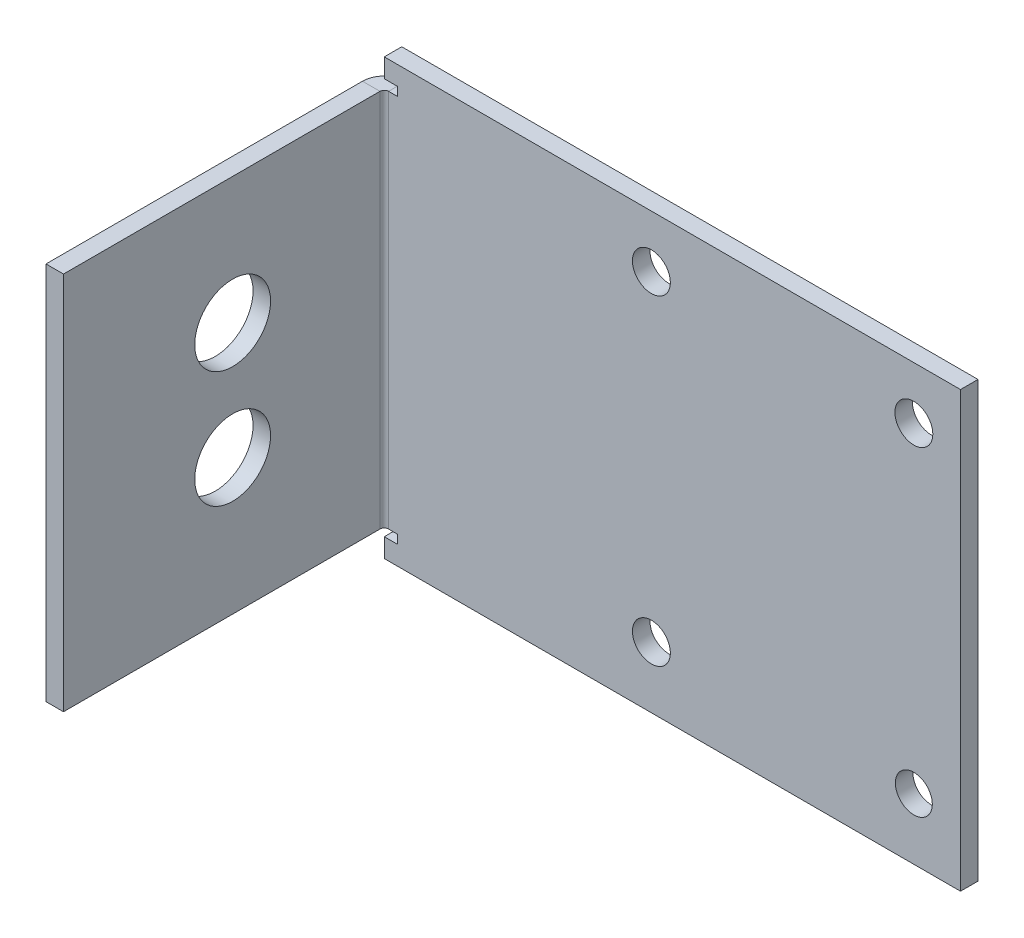
from build123d import *

# Parameters (mm, degrees)
IZIM1_W                       = 98.8
IZIM1_H                       = 74.5
TABAN_FLAN_1_DEPTH            = 3
KENAR_FLAN_1_STRIP_W          = 13.4732
KENAR_FLAN_1_STRIP_H          = 3
KENAR_FLAN_1_STRIP_CUT_DEPTH  = 65
KENAR_FLAN_1_RELIEF_W         = 14.9732
KENAR_FLAN_1_RELIEF_H         = 1.5
KENAR_FLAN_1_RELIEF_CUT_DEPTH = 3
KENAR_FLAN_1_DEPTH            = 65
IZIM9_R                       = 6.5
KES_EKSTR_ZYON1_DEPTH         = 10
IZIM11_R                      = 3.25
IZIM11_R_2                    = 3.166439954
KES_EKSTR_ZYON2_DEPTH         = 10


# Sheet-metal steps are written as plain solids
with BuildPart() as part:
    # Çizim1 → Taban-Flanş1 (new body)
    with BuildSketch(Plane.XY):
        Rectangle(IZIM1_W, IZIM1_H)
    extrude(amount=-TABAN_FLAN_1_DEPTH)

    # Kenar-Flanş1 strip (across the edge) → Kenar-Flanş1 strip cut (cut)
    with BuildSketch(Plane(origin=(-49.4, 32.5, 0), x_dir=(1, 0, 0), z_dir=(0, -1, 0))):
        with Locations((-6, -1.5)):
            Rectangle(KENAR_FLAN_1_STRIP_W, KENAR_FLAN_1_STRIP_H)
    extrude(amount=KENAR_FLAN_1_STRIP_CUT_DEPTH, mode=Mode.SUBTRACT)

    # Kenar-Flanş1 relief (on the sheet) → Kenar-Flanş1 relief cut (cut)
    with BuildSketch(Plane(origin=(-48.6634, 32.5, 0), x_dir=(1, 0, 0), z_dir=(0, 0, 1))):
        with Locations((-5.9866, 0.75)):
            Rectangle(KENAR_FLAN_1_RELIEF_W, KENAR_FLAN_1_RELIEF_H)
        with Locations((-5.9866, -65.75)):
            Rectangle(KENAR_FLAN_1_RELIEF_W, KENAR_FLAN_1_RELIEF_H)
    extrude(amount=-KENAR_FLAN_1_RELIEF_CUT_DEPTH, mode=Mode.SUBTRACT)

    # Kenar-Flanş1 section (across the edge) → Kenar-Flanş1 (add)
    with BuildSketch(Plane(origin=(-49.4, 32.5, 0), x_dir=(1, 0, 0), z_dir=(0, -1, 0))):
        with BuildLine():
            Line((-3, 0.7366), (-3, 55))
            Line((-3, 55), (0, 55))
            Line((0, 55), (0, 0.7366))
            ThreePointArc((0, 0.7366), (0.215745145, 0.215745145), (0.7366, 0))
            Line((0.7366, 0), (0.7366, -3))
            ThreePointArc((0.7366, -3), (-1.905575199, -1.905575199), (-3, 0.7366))
        make_face()
    extrude(amount=KENAR_FLAN_1_DEPTH)

    # Çizim9 → Kes-Ekstrüzyon1 (cut)
    with BuildSketch(Plane(origin=(-49.4, 0, 0), x_dir=(0, 0, -1), z_dir=(1, 0, 0))):
        with Locations((-26, 10.75)):
            Circle(IZIM9_R)
        with Locations((-26, -9.25)):
            Circle(IZIM9_R)
    extrude(amount=-KES_EKSTR_ZYON1_DEPTH, mode=Mode.SUBTRACT)

    # Çizim11 → Kes-Ekstrüzyon2 (cut)
    with BuildSketch(Plane.XY):
        with Locations((41.4, 28.25)):
            Circle(IZIM11_R)
        with Locations((-3.6, 28.25)):
            Circle(IZIM11_R)
        with Locations((-3.6, -26.75)):
            Circle(IZIM11_R)
        with Locations((41.4, -26.75)):
            Circle(IZIM11_R_2)
    extrude(amount=-KES_EKSTR_ZYON2_DEPTH, mode=Mode.SUBTRACT)


solid = part.part
